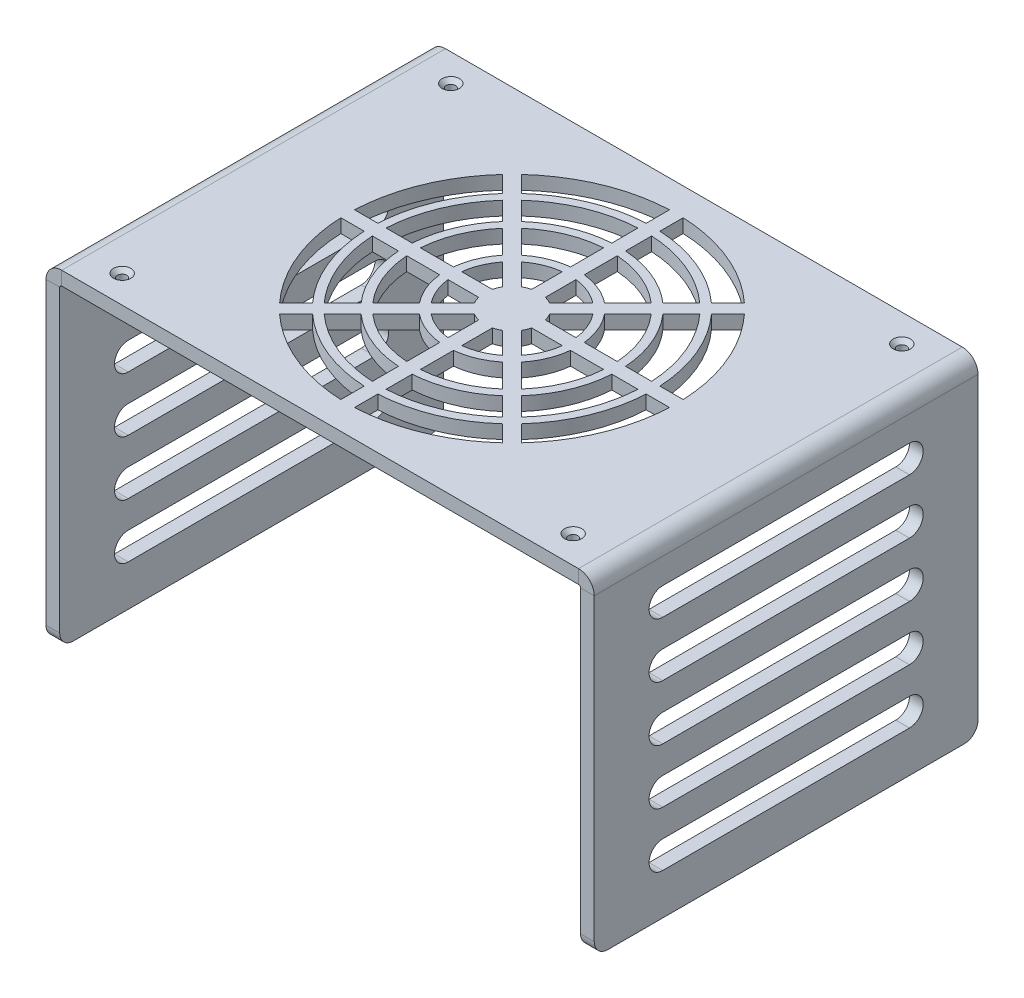
from build123d import *

# Parameters (mm, degrees)
BASE_SKETCH_W                                       = 200
BASE_SKETCH_H                                       = 140
BASE_FLANGE_DEPTH                                   = 5
EDGE_FLANGE_STRIP_W                                 = 21.4732
EDGE_FLANGE_STRIP_H                                 = 5
EDGE_FLANGE_STRIP_CUT_DEPTH                         = 140
EDGE_FLANGE_STRIP_2_W                               = 21.4732
EDGE_FLANGE_STRIP_2_H                               = 5
EDGE_FLANGE_STRIP_CUT_2_DEPTH                       = 140
EDGE_FLANGE_DEPTH                                   = 140
EDGE_FLANGE_BEND_DEPTH                              = 140
BREAK_CORNER1_START                                 = -100
BREAK_CORNER1_DEPTH                                 = 200
VENT_START                                          = -5
VENT_DEPTH                                          = 5
SLOT_EXTRUDED_CUT_DEPTH                             = 244.515913266
SLOT_EXTRUDED_CUT_DEPTH_BACK                        = 244.515913266
CSK_FOR_M3_COUNTERSUNK_FLAT_HEAD_SCREW1_D           = 3.4
CSK_FOR_M3_COUNTERSUNK_FLAT_HEAD_SCREW1_CSINK_D     = 6.3
CSK_FOR_M3_COUNTERSUNK_FLAT_HEAD_SCREW1_CSINK_ANGLE = 90


# Read off the part's stored shape, not the designer's step: Break-Corner1, Vent 
# Sheet-metal steps are written as plain solids
with BuildPart() as part:
    # Base Sketch → Base Flange (new body)
    with BuildSketch(Plane(origin=(0, 0, 0), x_dir=(1, 0, 0), z_dir=(0, 1, 0))):
        Rectangle(BASE_SKETCH_W, BASE_SKETCH_H)
    extrude(amount=-BASE_FLANGE_DEPTH)

    # Edge Flange strip (across the edge) → Edge Flange strip cut (cut)
    with BuildSketch(Plane(origin=(100, -5, -70), x_dir=(-1, 0, 0), z_dir=(0, 0, 1))):
        with Locations((-5, -2.5)):
            Rectangle(EDGE_FLANGE_STRIP_W, EDGE_FLANGE_STRIP_H)
    extrude(amount=EDGE_FLANGE_STRIP_CUT_DEPTH, mode=Mode.SUBTRACT)

    # Edge Flange strip 2 (across the edge) → Edge Flange strip cut 2 (cut)
    with BuildSketch(Plane(origin=(-100, -5, 70), x_dir=(1, 0, 0), z_dir=(0, 0, -1))):
        with Locations((-5, -2.5)):
            Rectangle(EDGE_FLANGE_STRIP_2_W, EDGE_FLANGE_STRIP_2_H)
    extrude(amount=EDGE_FLANGE_STRIP_CUT_2_DEPTH, mode=Mode.SUBTRACT)

    # Edge Flange section (across the edge) → Edge Flange (add)
    with BuildSketch(Plane(origin=(100, -5, -70), x_dir=(-1, 0, 0), z_dir=(0, 0, 1))):
        with BuildLine():
            Line((0, 0.7366), (0, 115))
            Line((0, 115), (5, 115))
            Line((5, 115), (5, 0.7366))
            ThreePointArc((5, 0.7366), (5.215745145, 0.215745145), (5.7366, 0))
            Line((5.7366, 0), (5.7366, -5))
            ThreePointArc((5.7366, -5), (1.680211239, -3.319788761), (0, 0.7366))
        make_face()
    extrude(amount=EDGE_FLANGE_DEPTH)

    # Edge Flange section 2 (across the edge) → Edge Flange bend (add)
    with BuildSketch(Plane(origin=(-100, -5, 70), x_dir=(1, 0, 0), z_dir=(0, 0, -1))):
        with BuildLine():
            Line((0, 0.7366), (0, 115))
            Line((0, 115), (5, 115))
            Line((5, 115), (5, 0.7366))
            ThreePointArc((5, 0.7366), (5.215745145, 0.215745145), (5.7366, 0))
            Line((5.7366, 0), (5.7366, -5))
            ThreePointArc((5.7366, -5), (1.680211239, -3.319788761), (0, 0.7366))
        make_face()
    extrude(amount=EDGE_FLANGE_BEND_DEPTH)

    # Break-Corner1 outline → Break-Corner1 (cut)
    with BuildSketch(Plane.YZ.offset(BREAK_CORNER1_START)):
        with BuildLine():
            Line((-120, -70), (-115, -70))
            ThreePointArc((-115, -70), (-118.535533906, -68.535533906), (-120, -65))
            Line((-120, -65), (-120, -70))
        make_face()
        with BuildLine():
            Line((-120, 70), (-120, 65))
            ThreePointArc((-120, 65), (-118.535533906, 68.535533906), (-115, 70))
            Line((-115, 70), (-120, 70))
        make_face()
    extrude(amount=BREAK_CORNER1_DEPTH, mode=Mode.SUBTRACT)

    # Vent outline → Vent (cut)
    with BuildSketch(Plane(origin=(0, 0, 0), x_dir=(1, 0, 0), z_dir=(0, 1, 0)).offset(VENT_START)):
        with BuildLine():
            Line((34.605500152, 38.141034058), (40.621979378, 44.157509446))
            add(Edge.make_bspline(
                [(40.621979378, 44.157509446), (39.790585169, 44.922599624), (37.455242153, 46.953125437), (33.387572095, 49.967701871), (28.330014112, 53.001531377), (22.99782421, 55.521178682), (17.445575011, 57.510033389), (11.724282839, 58.941007732), (6.716201929, 59.685707123), (3.629066895, 59.90125963), (2.499998151, 59.948151329)],
                knots=[0.131633228, 0.131633228, 0.131633228, 0.131633228, 0.140624264, 0.156249996, 0.171874264, 0.187499996, 0.203124264, 0.218749996, 0.234374264, 0.243366763, 0.243366763, 0.243366763, 0.243366763], degree=3))
            Line((2.499998151, 59.948151329), (2.499999994, 51.439567554))
            add(Edge.make_bspline(
                [(34.605500152, 38.141034058), (33.974906258, 38.713378699), (32.054034425, 40.371873247), (28.657687705, 42.888929636), (24.316607056, 45.492974892), (19.739823177, 47.655668402), (14.974131148, 49.362774836), (10.063368316, 50.591026556), (5.88178403, 51.212827888), (3.350790034, 51.398370193), (2.499999994, 51.439567554)],
                knots=[0.132728846, 0.132728846, 0.132728846, 0.132728846, 0.140624143, 0.156249996, 0.171874143, 0.187499996, 0.203124143, 0.218749996, 0.234374143, 0.242271146, 0.242271146, 0.242271146, 0.242271146], degree=3))
        make_face()
        with BuildLine():
            Line((51.439557816, 2.5), (59.948142949, 2.499997528))
            add(Edge.make_bspline(
                [(59.948142949, 2.499997528), (59.901253664, 3.628927843), (59.685705605, 6.716061991), (58.941074074, 11.723967876), (57.510085775, 17.445396954), (55.521319816, 22.997484549), (53.001618875, 28.329850189), (49.967906188, 33.387266361), (46.953240172, 37.455096318), (44.922724695, 39.790449075), (44.157509969, 40.621978678)],
                knots=[0.006633233, 0.006633233, 0.006633233, 0.006633233, 0.015624632, 0.031249996, 0.046874264, 0.062499996, 0.078124264, 0.093749996, 0.109374264, 0.118366763, 0.118366763, 0.118366763, 0.118366763], degree=3))
            Line((44.157509969, 40.621978678), (38.141033986, 34.60550009))
            add(Edge.make_bspline(
                [(51.439557816, 2.5), (51.398364497, 3.350651448), (51.212827562, 5.881644533), (50.591092856, 10.063053356), (49.362827233, 14.973953091), (47.655809533, 19.739483516), (45.493062391, 24.316443133), (42.889133953, 28.657381971), (40.371987255, 32.053888509), (38.713502459, 33.974769749), (38.141033986, 34.60550009)],
                knots=[0.007728852, 0.007728852, 0.007728852, 0.007728852, 0.015624571, 0.031249996, 0.046874143, 0.062499996, 0.078124143, 0.093749996, 0.109374143, 0.117271146, 0.117271146, 0.117271146, 0.117271146], degree=3))
        make_face()
        with BuildLine():
            Line((38.141034054, -34.605500157), (44.157509471, -40.621979347))
            add(Edge.make_bspline(
                [(44.157509471, -40.621979347), (44.922605311, -39.790578984), (46.953130655, -37.455235525), (49.967711129, -33.387558194), (53.00153546, -28.330006675), (55.521184702, -22.997808718), (57.510037243, -17.445567116), (58.941015975, -11.72422491), (59.685729257, -6.716153297), (59.901272783, -3.629017026), (59.948159383, -2.499997905)],
                knots=[0.881633228, 0.881633228, 0.881633228, 0.881633228, 0.890624331, 0.906249997, 0.921874331, 0.937499997, 0.953124331, 0.968749997, 0.984374665, 0.993366768, 0.993366768, 0.993366768, 0.993366768], degree=3))
            Line((59.948159383, -2.499997905), (51.439577386, -2.5))
            add(Edge.make_bspline(
                [(38.141034054, -34.605500157), (38.713378699, -33.974906262), (40.371873247, -32.054034428), (42.888929606, -28.6576877), (45.492975003, -24.31660707), (47.655667985, -19.739823122), (49.36277639, -14.974131355), (50.591031991, -10.063322629), (51.21285078, -5.881739731), (51.398384904, -3.350744582), (51.439577386, -2.5)],
                knots=[0.882728846, 0.882728846, 0.882728846, 0.882728846, 0.890624143, 0.906249996, 0.921874143, 0.937499996, 0.953124143, 0.968749996, 0.984374571, 0.992271151, 0.992271151, 0.992271151, 0.992271151], degree=3))
        make_face()
        with BuildLine():
            Line((2.499999994, -51.439567647), (2.499997326, -59.948151447))
            add(Edge.make_bspline(
                [(2.499997326, -59.948151447), (3.628890616, -59.901267069), (6.716026052, -59.685728113), (11.72393859, -58.941076207), (17.445405244, -57.510084888), (22.997499935, -55.521313), (28.329857654, -53.001615006), (33.387280254, -49.967896872), (37.455102949, -46.95323496), (39.790455262, -44.922719012), (40.621978711, -44.157509946)],
                knots=[0.756633228, 0.756633228, 0.756633228, 0.756633228, 0.765624331, 0.781249997, 0.796874331, 0.812499997, 0.828124331, 0.843749997, 0.859374331, 0.868366764, 0.868366764, 0.868366764, 0.868366764], degree=3))
            Line((40.621978711, -44.157509946), (34.605500086, -38.141033992))
            add(Edge.make_bspline(
                [(2.499999994, -51.439567647), (3.350605992, -51.398379206), (5.881600234, -51.212850449), (10.063007674, -50.591098292), (14.973953298, -49.362828787), (19.739483461, -47.655809117), (24.316443147, -45.493062502), (28.657381967, -42.889133923), (32.053888509, -40.371987258), (33.974769747, -38.713502464), (34.605500086, -38.141033992)],
                knots=[0.757728846, 0.757728846, 0.757728846, 0.757728846, 0.765624143, 0.781249996, 0.796874143, 0.812499996, 0.828124143, 0.843749996, 0.859374143, 0.867271146, 0.867271146, 0.867271146, 0.867271146], degree=3))
        make_face()
        with BuildLine():
            Line((-34.605499635, -38.141033532), (-40.621979806, -44.15750989))
            add(Edge.make_bspline(
                [(-40.621979806, -44.15750989), (-39.790582704, -44.922603163), (-37.455239976, -46.953129386), (-33.387561452, -49.967708543), (-28.330006757, -53.00153548), (-22.997808743, -55.521185045), (-17.445566934, -57.51003585), (-11.724266444, -58.941010991), (-6.716193554, -59.685708124), (-3.6290585, -59.901259985), (-2.499998111, -59.948151335)],
                knots=[0.631633228, 0.631633228, 0.631633228, 0.631633228, 0.640624298, 0.656249997, 0.671874331, 0.687499997, 0.703124331, 0.718749997, 0.734374331, 0.743366764, 0.743366764, 0.743366764, 0.743366764], degree=3))
            Line((-2.499998111, -59.948151335), (-2.5, -51.439567554))
            add(Edge.make_bspline(
                [(-34.605499635, -38.141033532), (-33.974902485, -38.713380762), (-32.054030013, -40.371874546), (-28.65768445, -42.888932249), (-24.316606961, -45.492974771), (-19.739823203, -47.655668434), (-14.974131142, -49.362774828), (-10.063368318, -50.591026559), (-5.881784033, -51.212827887), (-3.350790038, -51.398370193), (-2.5, -51.439567554)],
                knots=[0.632728847, 0.632728847, 0.632728847, 0.632728847, 0.640624182, 0.656249996, 0.671874143, 0.687499996, 0.703124143, 0.718749996, 0.734374143, 0.742271146, 0.742271146, 0.742271146, 0.742271146], degree=3))
        make_face()
        with BuildLine():
            Line((-51.439567643, -2.5), (-59.948151453, -2.499997286))
            add(Edge.make_bspline(
                [(-59.948151453, -2.499997286), (-59.901267423, -3.628882222), (-59.685729112, -6.716017677), (-58.941079468, -11.723922198), (-57.51008734, -17.445397161), (-55.521319395, -22.997484491), (-53.001618995, -28.329850212), (-49.967906131, -33.387266326), (-46.953240252, -37.45509642), (-44.922724589, -39.79044897), (-44.157509848, -40.621978567)],
                knots=[0.506633228, 0.506633228, 0.506633228, 0.506633228, 0.515624264, 0.531249996, 0.546874264, 0.562499996, 0.578124264, 0.593749996, 0.609374264, 0.618366763, 0.618366763, 0.618366763, 0.618366763], degree=3))
            Line((-44.157509848, -40.621978567), (-38.141034106, -34.6055002))
            add(Edge.make_bspline(
                [(-51.439567643, -2.5), (-51.398378796, -3.350614362), (-51.212849424, -5.88160859), (-50.591095031, -10.063024067), (-49.362826335, -14.973961381), (-47.655802722, -19.739498904), (-45.493058514, -24.31645059), (-42.889124663, -28.657395896), (-40.371982, -32.053895045), (-38.713496928, -33.974776044), (-38.141034106, -34.6055002)],
                knots=[0.507728847, 0.507728847, 0.507728847, 0.507728847, 0.515624221, 0.531249996, 0.546874221, 0.562499996, 0.578124221, 0.593749996, 0.609374221, 0.617271146, 0.617271146, 0.617271146, 0.617271146], degree=3))
        make_face()
        with BuildLine():
            Line((-38.141034047, 34.605500141), (-44.157509446, 40.621979378))
            add(Edge.make_bspline(
                [(-44.157509446, 40.621979378), (-44.922599624, 39.790585169), (-46.953125437, 37.455242153), (-49.967701871, 33.387572095), (-53.001531377, 28.330014112), (-55.521178682, 22.99782421), (-57.510033389, 17.445575011), (-58.941007732, 11.724282839), (-59.685707123, 6.716201929), (-59.90125963, 3.629066895), (-59.948151329, 2.499998151)],
                knots=[0.381633228, 0.381633228, 0.381633228, 0.381633228, 0.390624264, 0.406249996, 0.421874264, 0.437499996, 0.453124264, 0.468749996, 0.484374264, 0.493366763, 0.493366763, 0.493366763, 0.493366763], degree=3))
            Line((-59.948151329, 2.499998151), (-51.439567559, 2.5))
            add(Edge.make_bspline(
                [(-38.141034047, 34.605500141), (-38.713384319, 33.974900046), (-40.371878433, 32.054027802), (-42.88893892, 28.657673805), (-45.492978875, 24.316599606), (-47.655674797, 19.739807735), (-49.362777289, 14.974123065), (-50.591029817, 10.063351923), (-51.212828914, 5.881775678), (-51.398370603, 3.350781673), (-51.439567559, 2.5)],
                knots=[0.382728847, 0.382728847, 0.382728847, 0.382728847, 0.390624221, 0.406249996, 0.421874221, 0.437499996, 0.453124221, 0.468749996, 0.484374221, 0.492271146, 0.492271146, 0.492271146, 0.492271146], degree=3))
        make_face()
        with BuildLine():
            Line((-2.5, 51.43956765), (-2.499997286, 59.948151453))
            add(Edge.make_bspline(
                [(-2.499997286, 59.948151453), (-3.628882222, 59.901267423), (-6.716017677, 59.685729112), (-11.723922198, 58.941079468), (-17.44539716, 57.510087339), (-22.997484494, 55.521319397), (-28.329850204, 53.001618987), (-33.387266358, 49.967906158), (-37.455096319, 46.953240175), (-39.790449076, 44.922724697), (-40.621978679, 44.15750997)],
                knots=[0.256633228, 0.256633228, 0.256633228, 0.256633228, 0.265624264, 0.281249996, 0.296874264, 0.312499996, 0.328124264, 0.343749996, 0.359374264, 0.368366763, 0.368366763, 0.368366763, 0.368366763], degree=3))
            Line((-40.621978679, 44.15750997), (-34.605500123, 38.14103402))
            add(Edge.make_bspline(
                [(-2.5, 51.43956765), (-3.350605997, 51.398379209), (-5.881600236, 51.212850451), (-10.063007656, 50.591098256), (-14.973953367, 49.362828923), (-19.739487163, 47.655807188), (-24.316447882, 45.493062399), (-28.657392204, 42.889126643), (-32.053895162, 40.371982102), (-33.974775986, 38.713496875), (-34.605500123, 38.14103402)],
                knots=[0.257728846, 0.257728846, 0.257728846, 0.257728846, 0.265624143, 0.281249996, 0.296874143, 0.312499996, 0.328124182, 0.343749996, 0.359374221, 0.367271147, 0.367271147, 0.367271147, 0.367271147], degree=3))
        make_face()
        with BuildLine():
            Line((5.078758545, 8.614272373), (12.975836314, 16.51134574))
            add(Edge.make_bspline(
                [(12.975836314, 16.51134574), (12.551946417, 16.844492229), (11.001946018, 17.969082587), (8.088155963, 19.52653582), (4.926509297, 20.48561085), (3.035287808, 20.78642118), (2.49998202, 20.850586469)],
                knots=[0.143991972, 0.143991972, 0.143991972, 0.143991972, 0.15625, 0.1875, 0.21875, 0.231008033, 0.231008033, 0.231008033, 0.231008033], degree=3))
            Line((2.49998202, 20.850586469), (2.499988162, 9.682434408))
            add(Edge.make_bspline(
                [(5.078758545, 8.614272373), (4.676689469, 8.851292085), (3.839379732, 9.269080498), (2.951891362, 9.565726976), (2.499988162, 9.682434408)],
                knots=[0.165215222, 0.165215222, 0.165215222, 0.165215222, 0.1875, 0.209784739, 0.209784739, 0.209784739, 0.209784739], degree=3))
        make_face()
        with BuildLine():
            add(Edge.make_bspline(
                [(15.110422308, 18.645929079), (14.538651594, 19.109294222), (12.679813882, 20.479349994), (9.243606814, 22.316040937), (5.515104816, 23.447069653), (3.231932274, 23.792690678), (2.499980628, 23.869344993)],
                knots=[0.141608698, 0.141608698, 0.141608698, 0.141608698, 0.15625, 0.1875, 0.21875, 0.233391303, 0.233391303, 0.233391303, 0.233391303], degree=3))
            Line((15.110422308, 18.645929079), (23.62685401, 27.162387916))
            add(Edge.make_bspline(
                [(23.62685401, 27.162387916), (23.367329236, 27.38820242), (22.204623991, 28.370877427), (20.032604405, 29.980580267), (16.998041247, 31.8009013), (13.79876247, 33.312679068), (10.467380576, 34.506009239), (7.034641832, 35.364590294), (4.360382901, 35.762255582), (2.843370496, 35.88956778), (2.5, 35.913417293)],
                knots=[0.136061132, 0.136061132, 0.136061132, 0.136061132, 0.140623773, 0.156249994, 0.171873773, 0.187499994, 0.203123773, 0.218749994, 0.234373773, 0.238938858, 0.238938858, 0.238938858, 0.238938858], degree=3))
            Line((2.5, 35.913417293), (2.499980628, 23.869344993))
        make_face()
        with BuildLine():
            Line((-2.499985803, 9.682435017), (-2.49998269, 20.850586389))
            add(Edge.make_bspline(
                [(-2.49998269, 20.850586389), (-3.035288252, 20.78642111), (-4.926509514, 20.485610785), (-8.088155963, 19.52653582), (-11.00194622, 17.969082479), (-12.551946787, 16.844491961), (-12.975836852, 16.511345317)],
                knots=[0.268991972, 0.268991972, 0.268991972, 0.268991972, 0.28125, 0.3125, 0.34375, 0.356008034, 0.356008034, 0.356008034, 0.356008034], degree=3))
            Line((-12.975836852, 16.511345317), (-5.078756434, 8.614273618))
            add(Edge.make_bspline(
                [(-2.499985803, 9.682435017), (-2.951889818, 9.565727492), (-3.839378227, 9.269081121), (-4.676688003, 8.851292816), (-5.078756434, 8.614273618)],
                knots=[0.290215222, 0.290215222, 0.290215222, 0.290215222, 0.3125, 0.334784739, 0.334784739, 0.334784739, 0.334784739], degree=3))
        make_face()
        with BuildLine():
            add(Edge.make_bspline(
                [(-2.499980813, 23.869344974), (-3.231932397, 23.792690659), (-5.515104875, 23.447069635), (-9.243606814, 22.316040937), (-12.679813936, 20.479349965), (-14.538651693, 19.109294148), (-15.110422452, 18.645928962)],
                knots=[0.266608698, 0.266608698, 0.266608698, 0.266608698, 0.28125, 0.3125, 0.34375, 0.358391303, 0.358391303, 0.358391303, 0.358391303], degree=3))
            Line((-2.499980813, 23.869344974), (-2.5, 35.913417376))
            add(Edge.make_bspline(
                [(-2.5, 35.913417376), (-2.843186695, 35.889580616), (-4.360199619, 35.762280015), (-7.034281191, 35.36466203), (-10.467202725, 34.50606319), (-13.798422753, 33.312819783), (-16.997877339, 31.800988911), (-20.032298668, 29.980784553), (-22.204477115, 28.370989751), (-23.367190192, 27.38832331), (-23.62685395, 27.162387856)],
                knots=[0.261061132, 0.261061132, 0.261061132, 0.261061132, 0.265623773, 0.281249994, 0.296873773, 0.312499994, 0.328123773, 0.343749994, 0.359373773, 0.363938858, 0.363938858, 0.363938858, 0.363938858], degree=3))
            Line((-23.62685395, 27.162387856), (-15.110422452, 18.645928962))
        make_face()
        with BuildLine():
            Line((9.682435017, 2.499985803), (20.850586316, 2.499983291))
            add(Edge.make_bspline(
                [(20.850586316, 2.499983291), (20.786421046, 3.035288651), (20.485610726, 4.926509708), (19.52653582, 8.088155963), (17.969082481, 11.001946217), (16.844491965, 12.551946781), (16.511345323, 12.975836844)],
                knots=[0.018991976, 0.018991976, 0.018991976, 0.018991976, 0.03125, 0.0625, 0.09375, 0.106008033, 0.106008033, 0.106008033, 0.106008033], degree=3))
            Line((16.511345323, 12.975836844), (8.61427361, 5.078756446))
            add(Edge.make_bspline(
                [(9.682435017, 2.499985803), (9.565727492, 2.951889818), (9.26908112, 3.839378232), (8.851292811, 4.676688012), (8.61427361, 5.078756446)],
                knots=[0.040215222, 0.040215222, 0.040215222, 0.040215222, 0.0625, 0.084784739, 0.084784739, 0.084784739, 0.084784739], degree=3))
        make_face()
        with BuildLine():
            add(Edge.make_bspline(
                [(23.869344905, 2.499981471), (23.792690593, 3.231932834), (23.44706957, 5.515105087), (22.316040937, 9.243606814), (20.479349965, 12.679813936), (19.109294148, 14.538651693), (18.645928962, 15.110422452)],
                knots=[0.016608703, 0.016608703, 0.016608703, 0.016608703, 0.03125, 0.0625, 0.09375, 0.108391303, 0.108391303, 0.108391303, 0.108391303], degree=3))
            Line((23.869344905, 2.499981471), (35.913404791, 2.5))
            add(Edge.make_bspline(
                [(35.913404791, 2.5), (35.889563943, 2.843232135), (35.762258599, 4.360244141), (35.364656594, 7.034326871), (34.506061637, 10.467202518), (33.312820199, 13.798422809), (31.8009888, 16.997877324), (29.980784583, 20.032298672), (28.370989752, 22.204477115), (27.388323309, 23.367190191), (27.162387855, 23.626853949)],
                knots=[0.01106114, 0.01106114, 0.01106114, 0.01106114, 0.015624387, 0.031249994, 0.046873773, 0.062499994, 0.078123773, 0.093749994, 0.109373773, 0.113938858, 0.113938858, 0.113938858, 0.113938858], degree=3))
            Line((27.162387855, 23.626853949), (18.645928962, 15.110422452))
        make_face()
        with BuildLine():
            Line((8.614272373, -5.078758545), (16.51134574, -12.975836315))
            add(Edge.make_bspline(
                [(16.51134574, -12.975836315), (16.844492229, -12.551946418), (17.969082587, -11.001946018), (19.52653582, -8.088155963), (20.485610909, -4.926509103), (20.786421244, -3.035287409), (20.850586541, -2.499981419)],
                knots=[0.893991972, 0.893991972, 0.893991972, 0.893991972, 0.90625, 0.9375, 0.96875, 0.981008038, 0.981008038, 0.981008038, 0.981008038], degree=3))
            Line((20.850586541, -2.499981419), (9.682434408, -2.499988163))
            add(Edge.make_bspline(
                [(8.614272373, -5.078758545), (8.851292084, -4.676689469), (9.269080498, -3.839379733), (9.565726976, -2.951891363), (9.682434408, -2.499988163)],
                knots=[0.915215222, 0.915215222, 0.915215222, 0.915215222, 0.9375, 0.959784739, 0.959784739, 0.959784739, 0.959784739], degree=3))
        make_face()
        with BuildLine():
            add(Edge.make_bspline(
                [(18.645929079, -15.110422308), (19.109294222, -14.538651594), (20.479349994, -12.679813882), (22.316040937, -9.243606814), (23.447069717, -5.515104603), (23.792690744, -3.231931837), (23.869345062, -2.499979969)],
                knots=[0.891608698, 0.891608698, 0.891608698, 0.891608698, 0.90625, 0.9375, 0.96875, 0.983391307, 0.983391307, 0.983391307, 0.983391307], degree=3))
            Line((18.645929079, -15.110422308), (27.162387917, -23.626854011))
            add(Edge.make_bspline(
                [(27.162387917, -23.626854011), (27.388202421, -23.367329237), (28.370877426, -22.204623991), (29.980580237, -20.032604401), (31.800901412, -16.998041262), (33.312678651, -13.798762415), (34.506010793, -10.467380782), (35.364595729, -7.034596144), (35.762277006, -4.360338372), (35.889584458, -2.843325049), (35.913429882, -2.5)],
                knots=[0.886061132, 0.886061132, 0.886061132, 0.886061132, 0.890623773, 0.906249994, 0.921873773, 0.937499994, 0.953123773, 0.968749994, 0.984374387, 0.988938866, 0.988938866, 0.988938866, 0.988938866], degree=3))
            Line((35.913429882, -2.5), (23.869345062, -2.499979969))
        make_face()
        with BuildLine():
            Line((2.499985803, -9.682435017), (2.499982689, -20.850586389))
            add(Edge.make_bspline(
                [(2.499982689, -20.850586389), (3.035288252, -20.78642111), (4.926509513, -20.485610785), (8.088155963, -19.52653582), (11.001946217, -17.969082481), (12.551946781, -16.844491965), (12.975836844, -16.511345323)],
                knots=[0.768991972, 0.768991972, 0.768991972, 0.768991972, 0.78125, 0.8125, 0.84375, 0.856008033, 0.856008033, 0.856008033, 0.856008033], degree=3))
            Line((12.975836844, -16.511345323), (5.078756445, -8.614273611))
            add(Edge.make_bspline(
                [(2.499985803, -9.682435017), (2.951889818, -9.565727492), (3.839378231, -9.26908112), (4.676688011, -8.851292812), (5.078756445, -8.614273611)],
                knots=[0.790215222, 0.790215222, 0.790215222, 0.790215222, 0.8125, 0.834784739, 0.834784739, 0.834784739, 0.834784739], degree=3))
        make_face()
        with BuildLine():
            add(Edge.make_bspline(
                [(2.499980812, -23.869344974), (3.231932396, -23.792690659), (5.515104875, -23.447069635), (9.243606814, -22.316040937), (12.679813936, -20.479349965), (14.538651693, -19.109294148), (15.110422452, -18.645928962)],
                knots=[0.766608698, 0.766608698, 0.766608698, 0.766608698, 0.78125, 0.8125, 0.84375, 0.858391303, 0.858391303, 0.858391303, 0.858391303], degree=3))
            Line((2.499980812, -23.869344974), (2.5, -35.913417376))
            add(Edge.make_bspline(
                [(2.5, -35.913417376), (2.843186695, -35.889580616), (4.360199619, -35.762280015), (7.034281191, -35.36466203), (10.467202725, -34.50606319), (13.798422753, -33.312819783), (16.997877339, -31.800988911), (20.032298668, -29.980784553), (22.204477115, -28.370989751), (23.367190192, -27.38832331), (23.62685395, -27.162387856)],
                knots=[0.761061132, 0.761061132, 0.761061132, 0.761061132, 0.765623773, 0.781249994, 0.796873773, 0.812499994, 0.828123773, 0.843749994, 0.859373773, 0.863938858, 0.863938858, 0.863938858, 0.863938858], degree=3))
            Line((23.62685395, -27.162387856), (15.110422452, -18.645928962))
        make_face()
        with BuildLine():
            Line((-5.078758545, -8.614272373), (-12.975836315, -16.51134574))
            add(Edge.make_bspline(
                [(-12.975836315, -16.51134574), (-12.551946418, -16.844492229), (-11.001946018, -17.969082587), (-8.088155963, -19.52653582), (-4.926509298, -20.48561085), (-3.035287808, -20.78642118), (-2.499982021, -20.850586469)],
                knots=[0.643991972, 0.643991972, 0.643991972, 0.643991972, 0.65625, 0.6875, 0.71875, 0.731008033, 0.731008033, 0.731008033, 0.731008033], degree=3))
            Line((-2.499982021, -20.850586469), (-2.499988163, -9.682434408))
            add(Edge.make_bspline(
                [(-5.078758545, -8.614272373), (-4.676689469, -8.851292084), (-3.839379733, -9.269080498), (-2.951891363, -9.565726976), (-2.499988163, -9.682434408)],
                knots=[0.665215222, 0.665215222, 0.665215222, 0.665215222, 0.6875, 0.709784739, 0.709784739, 0.709784739, 0.709784739], degree=3))
        make_face()
        with BuildLine():
            add(Edge.make_bspline(
                [(-15.110422308, -18.645929079), (-14.538651594, -19.109294222), (-12.679813882, -20.479349994), (-9.243606814, -22.316040937), (-5.515104816, -23.447069653), (-3.231932274, -23.792690678), (-2.499980629, -23.869344993)],
                knots=[0.641608698, 0.641608698, 0.641608698, 0.641608698, 0.65625, 0.6875, 0.71875, 0.733391303, 0.733391303, 0.733391303, 0.733391303], degree=3))
            Line((-15.110422308, -18.645929079), (-23.626854009, -27.162387915))
            add(Edge.make_bspline(
                [(-23.626854009, -27.162387915), (-23.367329236, -27.38820242), (-22.204623991, -28.370877427), (-20.032604405, -29.980580267), (-16.998041247, -31.8009013), (-13.79876247, -33.312679068), (-10.467380576, -34.506009239), (-7.034641832, -35.364590294), (-4.360382901, -35.762255582), (-2.843370496, -35.88956778), (-2.5, -35.913417293)],
                knots=[0.636061132, 0.636061132, 0.636061132, 0.636061132, 0.640623773, 0.656249994, 0.671873773, 0.687499994, 0.703123773, 0.718749994, 0.734373773, 0.738938858, 0.738938858, 0.738938858, 0.738938858], degree=3))
            Line((-2.5, -35.913417293), (-2.499980629, -23.869344993))
        make_face()
        with BuildLine():
            Line((-9.682435017, -2.499985803), (-20.850586389, -2.49998269))
            add(Edge.make_bspline(
                [(-20.850586389, -2.49998269), (-20.78642111, -3.035288252), (-20.485610785, -4.926509514), (-19.52653582, -8.088155963), (-17.969082481, -11.001946217), (-16.844491965, -12.551946781), (-16.511345323, -12.975836844)],
                knots=[0.518991972, 0.518991972, 0.518991972, 0.518991972, 0.53125, 0.5625, 0.59375, 0.606008033, 0.606008033, 0.606008033, 0.606008033], degree=3))
            Line((-16.511345323, -12.975836844), (-8.614273611, -5.078756445))
            add(Edge.make_bspline(
                [(-9.682435017, -2.499985803), (-9.565727492, -2.951889818), (-9.26908112, -3.839378231), (-8.851292812, -4.676688011), (-8.614273611, -5.078756445)],
                knots=[0.540215222, 0.540215222, 0.540215222, 0.540215222, 0.5625, 0.584784739, 0.584784739, 0.584784739, 0.584784739], degree=3))
        make_face()
        with BuildLine():
            add(Edge.make_bspline(
                [(-23.869344974, -2.499980813), (-23.792690659, -3.231932397), (-23.447069635, -5.515104875), (-22.316040937, -9.243606814), (-20.479349965, -12.679813936), (-19.109294148, -14.538651693), (-18.645928962, -15.110422452)],
                knots=[0.516608698, 0.516608698, 0.516608698, 0.516608698, 0.53125, 0.5625, 0.59375, 0.608391303, 0.608391303, 0.608391303, 0.608391303], degree=3))
            Line((-23.869344974, -2.499980813), (-35.913417376, -2.5))
            add(Edge.make_bspline(
                [(-35.913417376, -2.5), (-35.889580616, -2.843186695), (-35.762280015, -4.360199619), (-35.36466203, -7.034281191), (-34.50606319, -10.467202725), (-33.312819783, -13.798422753), (-31.800988911, -16.997877339), (-29.980784553, -20.032298668), (-28.370989751, -22.204477115), (-27.38832331, -23.367190192), (-27.162387856, -23.62685395)],
                knots=[0.511061132, 0.511061132, 0.511061132, 0.511061132, 0.515623773, 0.531249994, 0.546873773, 0.562499994, 0.578123773, 0.593749994, 0.609373773, 0.613938858, 0.613938858, 0.613938858, 0.613938858], degree=3))
            Line((-27.162387856, -23.62685395), (-18.645928962, -15.110422452))
        make_face()
        with BuildLine():
            add(Edge.make_bspline(
                [(-18.645929079, 15.110422308), (-19.109294222, 14.538651594), (-20.479349994, 12.679813882), (-22.316040937, 9.243606814), (-23.447069653, 5.515104816), (-23.792690678, 3.231932274), (-23.869344993, 2.499980629)],
                knots=[0.391608698, 0.391608698, 0.391608698, 0.391608698, 0.40625, 0.4375, 0.46875, 0.483391303, 0.483391303, 0.483391303, 0.483391303], degree=3))
            Line((-18.645929079, 15.110422308), (-27.162387915, 23.626854009))
            add(Edge.make_bspline(
                [(-27.162387915, 23.626854009), (-27.38820242, 23.367329236), (-28.370877427, 22.204623991), (-29.980580267, 20.032604405), (-31.8009013, 16.998041247), (-33.312679068, 13.79876247), (-34.506009239, 10.467380576), (-35.364590294, 7.034641832), (-35.762255582, 4.360382901), (-35.88956778, 2.843370496), (-35.913417293, 2.5)],
                knots=[0.386061132, 0.386061132, 0.386061132, 0.386061132, 0.390623773, 0.406249994, 0.421873773, 0.437499994, 0.453123773, 0.468749994, 0.484373773, 0.488938858, 0.488938858, 0.488938858, 0.488938858], degree=3))
            Line((-35.913417293, 2.5), (-23.869344993, 2.499980629))
        make_face()
        with BuildLine():
            Line((-8.614272373, 5.078758545), (-16.51134574, 12.975836314))
            add(Edge.make_bspline(
                [(-16.51134574, 12.975836314), (-16.844492229, 12.551946417), (-17.969082587, 11.001946018), (-19.52653582, 8.088155963), (-20.48561085, 4.926509298), (-20.78642118, 3.035287808), (-20.850586469, 2.499982021)],
                knots=[0.393991972, 0.393991972, 0.393991972, 0.393991972, 0.40625, 0.4375, 0.46875, 0.481008033, 0.481008033, 0.481008033, 0.481008033], degree=3))
            Line((-20.850586469, 2.499982021), (-9.682434408, 2.499988163))
            add(Edge.make_bspline(
                [(-8.614272373, 5.078758545), (-8.851292085, 4.676689469), (-9.269080498, 3.839379733), (-9.565726976, 2.951891363), (-9.682434408, 2.499988163)],
                knots=[0.415215222, 0.415215222, 0.415215222, 0.415215222, 0.4375, 0.459784739, 0.459784739, 0.459784739, 0.459784739], degree=3))
        make_face()
        with BuildLine():
            add(Edge.make_bspline(
                [(25.75290725, 29.288441156), (25.420805878, 29.580551351), (24.110988174, 30.693630964), (21.701975366, 32.478970467), (18.414537855, 34.45098006), (14.948645188, 36.088741519), (11.33965488, 37.381512258), (7.620846958, 38.311642474), (4.654814766, 38.75269388), (2.941568101, 38.891820812), (2.499999995, 38.920110613)],
                knots=[0.13520905, 0.13520905, 0.13520905, 0.13520905, 0.140623868, 0.156249995, 0.171873868, 0.187499995, 0.203123868, 0.218749995, 0.234373868, 0.239790941, 0.239790941, 0.239790941, 0.239790941], degree=3))
            Line((25.75290725, 29.288441156), (32.481527584, 36.01706149))
            add(Edge.make_bspline(
                [(32.481527584, 36.01706149), (31.92214324, 36.52171633), (30.147716894, 38.049085033), (26.988313082, 40.390541442), (22.900107731, 42.842900011), (18.58992872, 44.879610417), (14.10184883, 46.487274407), (9.477146778, 47.6439776), (5.587286358, 48.222399283), (3.252564964, 48.39710806), (2.499999994, 48.435816708)],
                knots=[0.133207334, 0.133207334, 0.133207334, 0.133207334, 0.14062409, 0.156249996, 0.171874131, 0.187499996, 0.203124172, 0.218749996, 0.234374172, 0.241792659, 0.241792659, 0.241792659, 0.241792659], degree=3))
            Line((2.499999994, 48.435816708), (2.499999995, 38.920110613))
        make_face()
        with BuildLine():
            add(Edge.make_bspline(
                [(-2.5, 38.920110703), (-2.941384232, 38.891832671), (-4.654631355, 38.752717833), (-7.620486317, 38.31171421), (-11.339477029, 37.381566209), (-14.948305471, 36.088882235), (-18.414373947, 34.451067671), (-21.701669629, 32.479174754), (-24.110841546, 30.693743718), (-25.420667477, 29.58067298), (-25.75290719, 29.288441089)],
                knots=[0.26020905, 0.26020905, 0.26020905, 0.26020905, 0.265623868, 0.281249995, 0.296873868, 0.312499995, 0.328123868, 0.343749995, 0.359373868, 0.364790941, 0.364790941, 0.364790941, 0.364790941], degree=3))
            Line((-2.5, 38.920110703), (-2.5, 48.435816789))
            add(Edge.make_bspline(
                [(-2.5, 48.435816789), (-3.252397681, 48.397116749), (-5.587119339, 48.222420036), (-9.476818941, 47.644042851), (-14.101687078, 46.487323317), (-18.589616185, 44.879740269), (-22.89995399, 42.842979761), (-26.988024903, 40.390734436), (-30.147577465, 38.049193609), (-31.922012555, 36.521834039), (-32.481527496, 36.017061393)],
                knots=[0.258207334, 0.258207334, 0.258207334, 0.258207334, 0.265624172, 0.281249996, 0.296874172, 0.312499996, 0.328124172, 0.343749996, 0.359374172, 0.366792659, 0.366792659, 0.366792659, 0.366792659], degree=3))
            Line((-32.481527496, 36.017061393), (-25.75290719, 29.288441089))
        make_face()
        with BuildLine():
            add(Edge.make_bspline(
                [(38.920098689, 2.5), (38.891816429, 2.941429674), (38.752696041, 4.654675822), (38.311708774, 7.620531997), (37.381564655, 11.339476823), (36.088882651, 14.948305526), (34.451067559, 18.414373932), (32.479174784, 21.701669633), (30.693743718, 24.110841545), (29.580672979, 25.420667476), (29.288441087, 25.752907188)],
                knots=[0.010209057, 0.010209057, 0.010209057, 0.010209057, 0.015624434, 0.031249995, 0.046873868, 0.062499995, 0.078123868, 0.093749995, 0.109373868, 0.114790941, 0.114790941, 0.114790941, 0.114790941], degree=3))
            Line((38.920098689, 2.5), (48.435806639, 2.5))
            add(Edge.make_bspline(
                [(48.435806639, 2.5), (48.397102265, 3.252434764), (48.222398278, 5.587155332), (47.644040717, 9.476848227), (46.487324204, 14.101678788), (44.879747084, 18.589600798), (42.842983631, 22.899946525), (40.390743751, 26.988011008), (38.049198782, 30.147570833), (36.521839638, 31.922006326), (36.017061381, 32.481527484)],
                knots=[0.00820734, 0.00820734, 0.00820734, 0.00820734, 0.015624545, 0.031249996, 0.04687409, 0.062499996, 0.07812409, 0.093749996, 0.10937409, 0.116792658, 0.116792658, 0.116792658, 0.116792658], degree=3))
            Line((36.017061381, 32.481527484), (29.288441087, 25.752907188))
        make_face()
        with BuildLine():
            add(Edge.make_bspline(
                [(29.288441154, -25.752907254), (29.580551351, -25.420805881), (30.693630963, -24.110988176), (32.478970437, -21.701975362), (34.450980172, -18.41453787), (36.088741103, -14.948645132), (37.381513812, -11.339655087), (38.311647908, -7.62080127), (38.752715679, -4.654770294), (38.891837058, -2.941522656), (38.920122629, -2.5)],
                knots=[0.885209049, 0.885209049, 0.885209049, 0.885209049, 0.890623868, 0.906249995, 0.921873868, 0.937499995, 0.953123868, 0.968749995, 0.984374434, 0.989790948, 0.989790948, 0.989790948, 0.989790948], degree=3))
            Line((29.288441154, -25.752907254), (36.017061454, -32.481527557))
            add(Edge.make_bspline(
                [(36.017061454, -32.481527557), (36.521721898, -31.922136992), (38.049090184, -30.147710243), (40.390548694, -26.988302842), (42.842900216, -22.900103011), (44.87961197, -18.589924967), (46.487275672, -14.101848949), (47.643982619, -9.47710526), (48.222419781, -5.587246068), (48.397121846, -3.252523645), (48.435826226, -2.5)],
                knots=[0.883207334, 0.883207334, 0.883207334, 0.883207334, 0.890624172, 0.906249996, 0.921874172, 0.937499996, 0.953124172, 0.968749996, 0.984374586, 0.991792664, 0.991792664, 0.991792664, 0.991792664], degree=3))
            Line((48.435826226, -2.5), (38.920122629, -2.5))
        make_face()
        with BuildLine():
            add(Edge.make_bspline(
                [(2.499999996, -38.920110703), (2.941384229, -38.891832671), (4.654631353, -38.752717834), (7.620486317, -38.31171421), (11.339477029, -37.381566209), (14.948305471, -36.088882235), (18.414373947, -34.451067671), (21.701669629, -32.479174754), (24.110841545, -30.693743719), (25.420667475, -29.580672982), (25.752907186, -29.288441092)],
                knots=[0.760209049, 0.760209049, 0.760209049, 0.760209049, 0.765623868, 0.781249995, 0.796873868, 0.812499995, 0.828123868, 0.843749995, 0.859373868, 0.864790941, 0.864790941, 0.864790941, 0.864790941], degree=3))
            Line((2.499999996, -38.920110703), (2.499999994, -48.43581679))
            add(Edge.make_bspline(
                [(2.499999994, -48.43581679), (3.252397677, -48.39711675), (5.587119337, -48.222420036), (9.476818941, -47.644042851), (14.101687078, -46.487323316), (18.589616185, -44.879740269), (22.89995399, -42.842979761), (26.988024903, -40.390734436), (30.147577464, -38.04919361), (31.922012552, -36.521834041), (32.481527491, -36.017061397)],
                knots=[0.758207334, 0.758207334, 0.758207334, 0.758207334, 0.765624172, 0.781249996, 0.796874172, 0.812499996, 0.828124172, 0.843749996, 0.859374172, 0.866792659, 0.866792659, 0.866792659, 0.866792659], degree=3))
            Line((32.481527491, -36.017061397), (25.752907186, -29.288441092))
        make_face()
        with BuildLine():
            add(Edge.make_bspline(
                [(-25.752907252, -29.288441153), (-25.42080588, -29.580551349), (-24.110988176, -30.693630963), (-21.701975366, -32.478970467), (-18.414537855, -34.45098006), (-14.948645188, -36.088741519), (-11.33965488, -37.381512258), (-7.620846958, -38.311642474), (-4.654814767, -38.75269388), (-2.941568104, -38.891820812), (-2.5, -38.920110613)],
                knots=[0.635209049, 0.635209049, 0.635209049, 0.635209049, 0.640623868, 0.656249995, 0.671873868, 0.687499995, 0.703123868, 0.718749995, 0.734373868, 0.739790941, 0.739790941, 0.739790941, 0.739790941], degree=3))
            Line((-25.752907252, -29.288441153), (-32.481527556, -36.017061453))
            add(Edge.make_bspline(
                [(-32.481527556, -36.017061453), (-31.922136991, -36.521721896), (-30.147710242, -38.049090183), (-26.988302846, -40.390548721), (-22.900102998, -42.842900115), (-18.589925018, -44.879612346), (-14.10184876, -46.487274271), (-9.477146797, -47.643977637), (-5.58728636, -48.222399281), (-3.252564967, -48.397108057), (-2.5, -48.435816705)],
                knots=[0.633207334, 0.633207334, 0.633207334, 0.633207334, 0.640624172, 0.656249996, 0.671874172, 0.687499996, 0.703124172, 0.718749996, 0.734374172, 0.741792659, 0.741792659, 0.741792659, 0.741792659], degree=3))
            Line((-2.5, -48.435816705), (-2.5, -38.920110613))
        make_face()
        with BuildLine():
            add(Edge.make_bspline(
                [(-38.920110703, -2.5), (-38.891832671, -2.941384232), (-38.752717833, -4.654631355), (-38.31171421, -7.620486317), (-37.381566209, -11.339477029), (-36.088882235, -14.948305471), (-34.451067671, -18.414373947), (-32.479174754, -21.701669629), (-30.693743719, -24.110841544), (-29.580672982, -25.420667475), (-29.288441092, -25.752907186)],
                knots=[0.51020905, 0.51020905, 0.51020905, 0.51020905, 0.515623868, 0.531249995, 0.546873868, 0.562499995, 0.578123868, 0.593749995, 0.609373868, 0.614790941, 0.614790941, 0.614790941, 0.614790941], degree=3))
            Line((-38.920110703, -2.5), (-48.43581679, -2.5))
            add(Edge.make_bspline(
                [(-48.43581679, -2.5), (-48.39711675, -3.252397681), (-48.222420035, -5.587119339), (-47.644042851, -9.476818941), (-46.487323316, -14.101687078), (-44.879740269, -18.589616185), (-42.842979761, -22.89995399), (-40.390734436, -26.988024903), (-38.04919361, -30.147577463), (-36.521834041, -31.922012552), (-36.017061397, -32.481527491)],
                knots=[0.508207334, 0.508207334, 0.508207334, 0.508207334, 0.515624172, 0.531249996, 0.546874172, 0.562499996, 0.578124172, 0.593749996, 0.609374172, 0.616792659, 0.616792659, 0.616792659, 0.616792659], degree=3))
            Line((-36.017061397, -32.481527491), (-29.288441092, -25.752907186))
        make_face()
        with BuildLine():
            add(Edge.make_bspline(
                [(-29.288441155, 25.752907249), (-29.580551351, 25.420805878), (-30.693630964, 24.110988175), (-32.478970467, 21.701975366), (-34.45098006, 18.414537855), (-36.088741519, 14.948645188), (-37.381512258, 11.33965488), (-38.311642474, 7.620846958), (-38.75269388, 4.654814768), (-38.891820812, 2.941568104), (-38.920110613, 2.5)],
                knots=[0.38520905, 0.38520905, 0.38520905, 0.38520905, 0.390623868, 0.406249995, 0.421873868, 0.437499995, 0.453123868, 0.468749995, 0.484373868, 0.489790941, 0.489790941, 0.489790941, 0.489790941], degree=3))
            Line((-29.288441155, 25.752907249), (-36.017061457, 32.481527551))
            add(Edge.make_bspline(
                [(-36.017061457, 32.481527551), (-36.521721899, 31.922136988), (-38.049090184, 30.14771024), (-40.390548721, 26.988302846), (-42.842900115, 22.900102998), (-44.879612346, 18.589925018), (-46.487274271, 14.10184876), (-47.643977637, 9.477146797), (-48.222399281, 5.58728636), (-48.397108057, 3.252564967), (-48.435816705, 2.5)],
                knots=[0.383207334, 0.383207334, 0.383207334, 0.383207334, 0.390624172, 0.406249996, 0.421874172, 0.437499996, 0.453124172, 0.468749996, 0.484374172, 0.491792659, 0.491792659, 0.491792659, 0.491792659], degree=3))
            Line((-48.435816705, 2.5), (-38.920110613, 2.5))
        make_face()
    extrude(amount=VENT_DEPTH, mode=Mode.SUBTRACT)

    # Slot Sketch → Slot Extruded Cut (cut, two sides: drawn at the far end of the back side and taken through both)
    with BuildSketch(Plane(origin=(100, 0, 0), x_dir=(0, 0, -1), z_dir=(1, 0, 0)).offset(-SLOT_EXTRUDED_CUT_DEPTH_BACK)):
        with BuildLine():
            Line((-45, -15), (45, -15))
            ThreePointArc((45, -15), (50, -20), (45, -25))
            Line((45, -25), (-45, -25))
            ThreePointArc((-45, -25), (-50, -20), (-45, -15))
        make_face()
        with BuildLine():
            Line((-45, -45), (45, -45))
            ThreePointArc((45, -45), (50, -40), (45, -35))
            Line((45, -35), (-45, -35))
            ThreePointArc((-45, -35), (-50, -40), (-45, -45))
        make_face()
        with BuildLine():
            Line((-45, -65), (45, -65))
            ThreePointArc((45, -65), (50, -60), (45, -55))
            Line((45, -55), (-45, -55))
            ThreePointArc((-45, -55), (-50, -60), (-45, -65))
        make_face()
        with BuildLine():
            Line((-45, -85), (45, -85))
            ThreePointArc((45, -85), (50, -80), (45, -75))
            Line((45, -75), (-45, -75))
            ThreePointArc((-45, -75), (-50, -80), (-45, -85))
        make_face()
        with BuildLine():
            Line((-45, -105), (45, -105))
            ThreePointArc((45, -105), (50, -100), (45, -95))
            Line((45, -95), (-45, -95))
            ThreePointArc((-45, -95), (-50, -100), (-45, -105))
        make_face()
    extrude(amount=SLOT_EXTRUDED_CUT_DEPTH + SLOT_EXTRUDED_CUT_DEPTH_BACK, mode=Mode.SUBTRACT)

    # CSK for M3 Countersunk Flat Head Screw1 (through all)
    with Locations(Plane(origin=(0, 0, 0), x_dir=(1, 0, 0), z_dir=(0, 1, 0))):
        with Locations((-82.2634, 59.948173593), (82.2634, 59.948173593), (82.2634, -59.948173593), (-82.2634, -59.948173593)):
            CounterSinkHole(CSK_FOR_M3_COUNTERSUNK_FLAT_HEAD_SCREW1_D / 2, CSK_FOR_M3_COUNTERSUNK_FLAT_HEAD_SCREW1_CSINK_D / 2, counter_sink_angle=CSK_FOR_M3_COUNTERSUNK_FLAT_HEAD_SCREW1_CSINK_ANGLE)


solid = part.part
